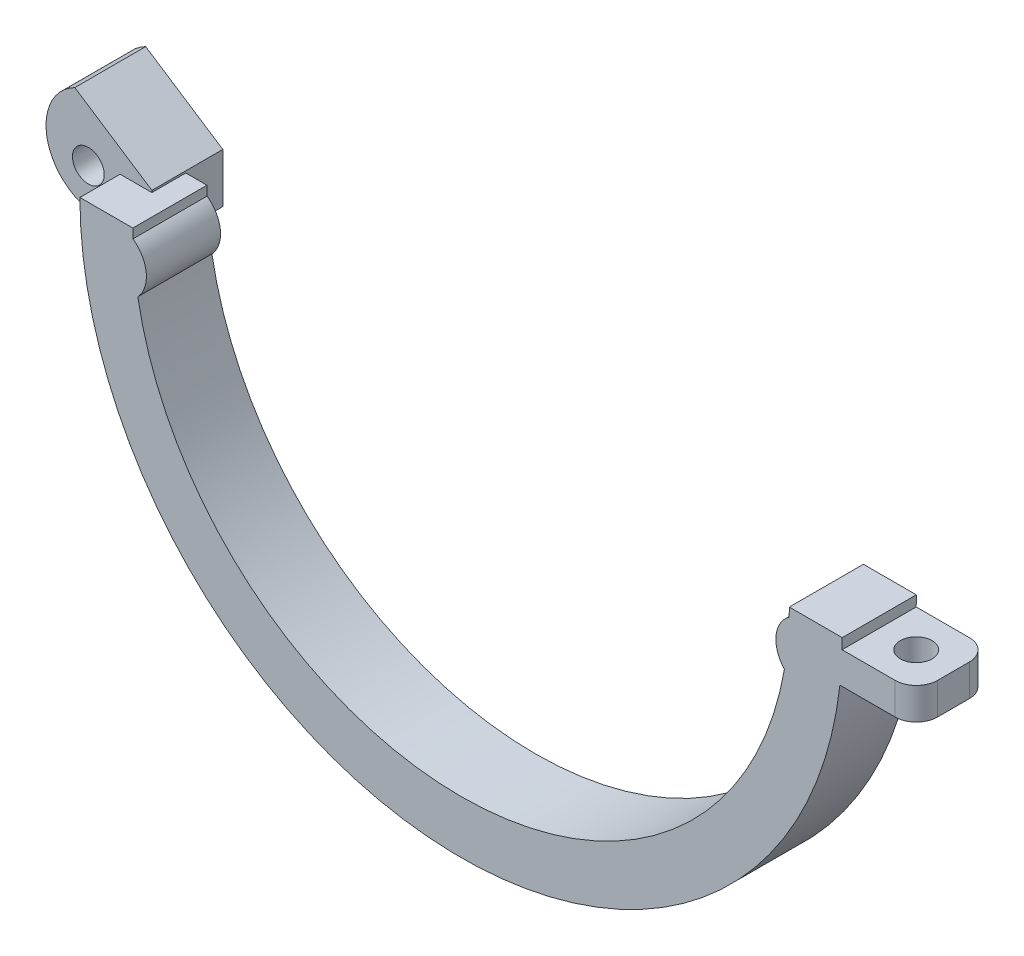
from build123d import *

# Parameters (mm, degrees)
BOSS_EXTRUDE2_DEPTH      = 7
BOSS_EXTRUDE7_DEPTH      = 3.5
BOSS_EXTRUDE7_DEPTH_BACK = 3.2
SKETCH7_W                = 10
SKETCH7_H                = 10
SKETCH8_R                = 1.5
CUT_EXTRUDE3_DEPTH       = 10
FILLET1_R                = 5
FILLET2_R                = 5
FILLET3_R                = 5
SKETCH9_W                = 8
SKETCH9_H                = 3
BOSS_EXTRUDE8_DEPTH      = 7
SKETCH10_R               = 1.5
CUT_EXTRUDE4_DEPTH       = 10
FILLET4_R                = 2
FILLET5_R                = 2
CUT_EXTRUDE5_DEPTH       = 7


with BuildPart() as part:
    # Sketch1 → Boss-Extrude2 (new body)
    with BuildSketch(Plane.XY):
        with BuildLine():
            Line((36, 0), (31, 0))
            ThreePointArc((31, 0), (30.997217748, -0.415321451), (30.98887149, -0.830568352))
            ThreePointArc((30.98887149, -0.830568352), (29.746163614, -2.974229152), (30.539836631, -5.321501534))
            ThreePointArc((30.539836631, -5.321501534), (0.032857513, -30.999982587), (-30.528487289, -5.386229095))
            ThreePointArc((-30.528487289, -5.386229095), (-29.731741507, -3.029439038), (-30.987456583, -0.881779181))
            ThreePointArc((-30.987456583, -0.881779181), (-30.996863987, -0.440934196), (-31, 0))
            Line((-31, 0), (-36, 0))
            ThreePointArc((-36, 0), (0, -36), (36, 0))
        make_face()
    extrude(amount=BOSS_EXTRUDE2_DEPTH)

    # Sketch7 → Boss-Extrude7 (add, two sides: drawn at the far end of the back side and taken through both)
    with BuildSketch(Plane(origin=(0, 0, 0), x_dir=(-1, 0, 0), z_dir=(0, 0, -1)).offset(-BOSS_EXTRUDE7_DEPTH_BACK)):
        with Locations((38, 0.5)):
            Rectangle(SKETCH7_W, SKETCH7_H)
    extrude(amount=BOSS_EXTRUDE7_DEPTH + BOSS_EXTRUDE7_DEPTH_BACK)

    # Sketch8 → Cut-Extrude3 (cut)
    with BuildSketch(Plane.XY.offset(3.2)):
        with Locations((-39, -0.8)):
            Circle(SKETCH8_R)
    extrude(amount=-CUT_EXTRUDE3_DEPTH, mode=Mode.SUBTRACT)

    # Fillet1
    fillet1_edges = [part.edges().sort_by_distance(p)[0] for p in [
        (-43, 5.5, -0.15),
    ]]
    fillet(fillet1_edges, radius=FILLET1_R)

    # Fillet2
    fillet2_edges = [part.edges().sort_by_distance(p)[0] for p in [
        (-43, -4.5, -0.15),
    ]]
    fillet(fillet2_edges, radius=FILLET2_R - 0.0001)  # a hair under: the kernel refuses the full size

    # Fillet3
    fillet3_edges = [part.edges().sort_by_distance(p)[0] for p in [
        (-33, 5.5, -0.15),
    ]]
    fillet(fillet3_edges, radius=FILLET3_R - 0.0001)  # a hair under: the kernel refuses the full size

    # Sketch9 → Boss-Extrude8 (add)
    with BuildSketch(Plane.XY.offset(7)):
        with Locations((39, -2.5)):
            Rectangle(SKETCH9_W, SKETCH9_H)
    extrude(amount=-BOSS_EXTRUDE8_DEPTH)

    # Sketch10 → Cut-Extrude4 (cut)
    with BuildSketch(Plane(origin=(0, -1, 0), x_dir=(1, 0, 0), z_dir=(0, 1, 0))):
        with Locations(Location((39.486108431, -3.5, 0), (0, 0, 180))):
            Circle(SKETCH10_R)
    extrude(amount=-CUT_EXTRUDE4_DEPTH, mode=Mode.SUBTRACT)

    # Fillet4
    fillet4_edges = [part.edges().sort_by_distance(p)[0] for p in [
        (43, -2.5, 7),
    ]]
    fillet(fillet4_edges, radius=FILLET4_R)

    # Fillet5
    fillet5_edges = [part.edges().sort_by_distance(p)[0] for p in [
        (43, -2.5, 0),
    ]]
    fillet(fillet5_edges, radius=FILLET5_R)

    # Sketch11 → Cut-Extrude5 (cut)
    with BuildSketch(Plane(origin=(0, 0, -3.5), x_dir=(-1, 0, 0), z_dir=(0, 0, -1))):
        with BuildLine():
            Line((33, 0.5), (33, 0.179462338))
            Line((33, 0.179462338), (40.279801287, 4.950000684))
            ThreePointArc((40.279801287, 4.950000684), (39.17260321, 5.3605557), (38, 5.5))
            ThreePointArc((38, 5.5), (34.464466094, 4.035533906), (33, 0.5))
        make_face()
    extrude(amount=-CUT_EXTRUDE5_DEPTH, mode=Mode.SUBTRACT)


with BuildPart() as cut_extrude5_kept_piece:
    # of the separate pieces the step leaves, the one the design keeps (cut_extrude5_pieces_kept)
    add(part.part.solids().sort_by_distance((43, -4, 2))[0])


solid = cut_extrude5_kept_piece.part
